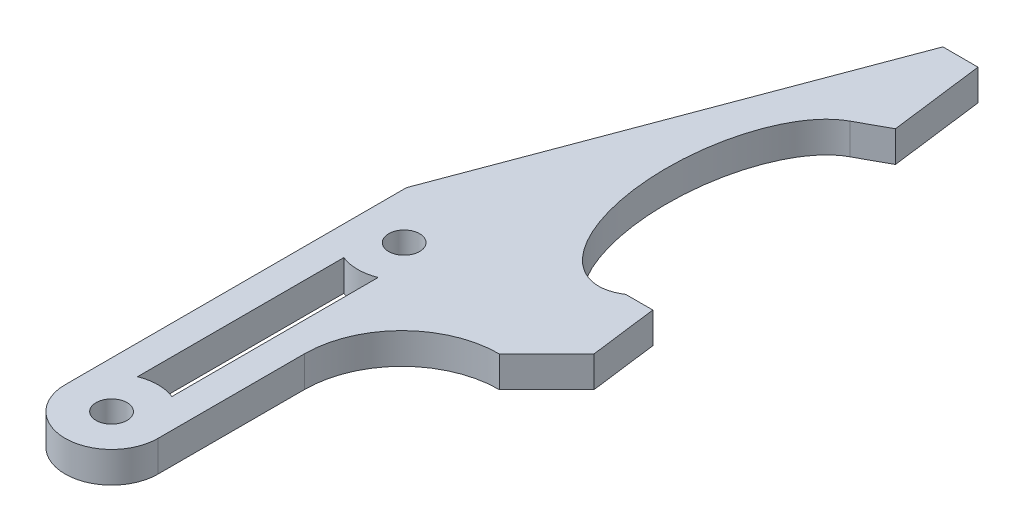
from build123d import *

# Parameters (mm, degrees)
CROQUIS1_R              = 1.5875
SALIENTE_EXTRUIR1_DEPTH = 3.175
CORTAR_EXTRUIR1_DEPTH   = 3.175
CORTAR_EXTRUIR3_DEPTH   = 10
CROQUIS5_R              = 10
CORTAR_EXTRUIR8_DEPTH   = 10
REDONDEO2_R             = 2
ESQUISSE1_RX            = 14
ESQUISSE1_RY            = 7
ENL_V_MAT_EXTRU_1_DEPTH = 43.027736377
ESQUISSE2_W             = 6.812613354
ESQUISSE2_H             = 3.3
ENL_V_MAT_EXTRU_2_DEPTH = 43.027736555


with BuildPart() as part:
    # Croquis1 → Saliente-Extruir1 (new body)
    with BuildSketch(Plane(origin=(0, 0, 0), x_dir=(1, 0, 0), z_dir=(0, 1, 0))):
        with BuildLine():
            Line((-12.5, 0), (-12.5, -40))
            Line((-12.5, -40), (-2.975, -40))
            Line((-2.975, -40), (-2.975, -20))
            ThreePointArc((-2.975, -20), (-0.046067812, -12.928932188), (7.025, -10))
            Line((7.025, -10), (12.5, -10))
            Line((12.5, -10), (12.5, 40))
            Line((12.5, 40), (2.5, 40))
            Line((2.5, 40), (-12.5, 0))
        make_face()
        with Locations(Location((-7.7375, -5, 0), (0, 0, 270))):
            Circle(CROQUIS1_R, mode=Mode.SUBTRACT)
        with Locations(Location((-7.7375, -35, 0), (0, 0, 270))):
            Circle(CROQUIS1_R, mode=Mode.SUBTRACT)
    extrude(amount=SALIENTE_EXTRUIR1_DEPTH)

    # Croquis2 → Cortar-Extruir1 (cut)
    with BuildSketch(Plane(origin=(0, 3.175, 0), x_dir=(1, 0, 0), z_dir=(0, 1, 0))):
        Polygon((12.5, -10), (6.1, 40), (12.5, 40), align=None)
    extrude(amount=-CORTAR_EXTRUIR1_DEPTH, mode=Mode.SUBTRACT)

    # Croquis3 → Cortar-Extruir3 (cut)
    with BuildSketch(Plane(origin=(0, 3.175, 0), x_dir=(1, 0, 0), z_dir=(0, 1, 0))):
        with BuildLine():
            ThreePointArc((-5.975, -30.575635639), (-7.7375, -30.2375), (-9.5, -30.575635639))
            Line((-9.5, -30.575635639), (-9.5, -9.427055314))
            ThreePointArc((-9.5, -9.427055314), (-7.7375, -9.765), (-5.975, -9.427055314))
            Line((-5.975, -9.427055314), (-5.975, -14.803847577))
            Line((-5.975, -14.803847577), (-5.975, -30.575635639))
        make_face()
        with BuildLine():
            ThreePointArc((-12.5, -35), (-7.7375, -39.7625), (-2.975, -35))
            Line((-2.975, -35), (-2.975, -40))
            Line((-2.975, -40), (-12.5, -40))
            Line((-12.5, -40), (-12.5, -35))
        make_face()
    extrude(amount=-CORTAR_EXTRUIR3_DEPTH, mode=Mode.SUBTRACT)

    # Croquis5 → Cortar-Extruir8 (cut)
    with BuildSketch(Plane(origin=(0, 3.175, 0), x_dir=(1, 0, 0), z_dir=(0, 1, 0))):
        with Locations((9.3, 15)):
            Circle(CROQUIS5_R)
        Polygon((7.025, -10), (11.878723404, -5.146276596), (12.5, -10), align=None)
    extrude(amount=-CORTAR_EXTRUIR8_DEPTH, mode=Mode.SUBTRACT)

    # Redondeo2
    redondeo2_edges = [part.edges().sort_by_distance(p)[0] for p in [
        (8.030358645, 1.5875, -24.919073083),
        (10.569641355, 1.5875, -5.080926917),
    ]]
    fillet(redondeo2_edges, radius=REDONDEO2_R)

    # Esquisse1 → Enlèv. mat.-Extru.1 (cut, through all)
    with BuildSketch(Plane(origin=(0, 3.175, 0), x_dir=(1, 0, 0), z_dir=(0, 1, 0))):
        with Locations(Location((6.096336345, 15.099252248), (0, 0, -90))):
            Ellipse(ESQUISSE1_RX, ESQUISSE1_RY)
    extrude(amount=-ENL_V_MAT_EXTRU_1_DEPTH, mode=Mode.SUBTRACT)

    # Esquisse2 → Enlèv. mat.-Extru.2 (cut, through all)
    with BuildSketch(Plane(origin=(0, 3.175, 0), x_dir=(1, 0, 0), z_dir=(0, 1, 0))):
        with Locations((11.483320122, 3.411473453)):
            Rectangle(ESQUISSE2_W, ESQUISSE2_H)
    extrude(amount=-ENL_V_MAT_EXTRU_2_DEPTH, mode=Mode.SUBTRACT)

    # Chanfrein1
    # the kernel refuses this chamfer: 5, 3.65932295 mm, written as the material it takes off along each edge
    with BuildSketch(Plane(origin=(7.533468678, -8.470907308, -28.801025952), x_dir=(-0.009849351174311172, 0, -0.9999514939643048), z_dir=(0, 1, 0))) as chanfrein1_piece_1:
        with BuildLine():
            Line((1.589139403, 0), (-0.217570658, 3.381370478))
            Line((-0.217570658, 3.381370478), (-0.306685884, 3.336000041))
            ThreePointArc((-0.306685884, 3.336000041), (0.203744233, 1.713157434), (-0.091827617, 0.03959405))
            Line((-0.091827617, 0.03959405), (0.011718833, -0.099310971))
            ThreePointArc((0.011718833, -0.099310971), (0.795376625, -0.006838256), (1.600858236, -0.099310971))
            Line((1.600858236, -0.099310971), (1.589139403, 0))
        make_face()
    extrude(amount=20.116814349, mode=Mode.SUBTRACT)


solid = part.part
